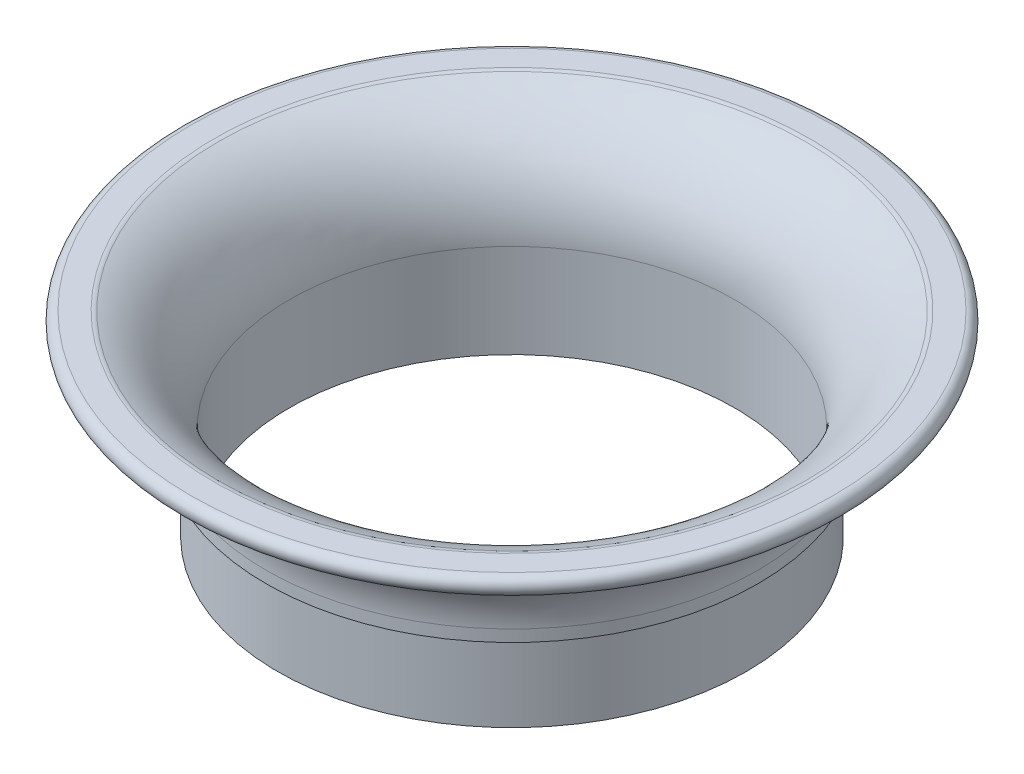
from build123d import *


with BuildPart() as part:
    # Sketch1 → Revolve1 (revolve)
    with BuildSketch(Plane.XY):
        with BuildLine():
            Line((-60.325, -12.7), (-60.325, 12.7))
            ThreePointArc((-60.325, 12.7), (-65.615261982, 29.458507125), (-79.568413516, 40.14232644))
            ThreePointArc((-79.568413516, 40.14232644), (-80.101043736, 40.284456577), (-80.650230019, 40.332314203))
            Line((-80.650230019, 40.332314203), (-87.000230019, 40.332314203))
            ThreePointArc((-87.000230019, 40.332314203), (-89.287995714, 37.794620319), (-86.865795547, 35.384909036))
            ThreePointArc((-86.865795547, 35.384909036), (-72.453781222, 27.884476635), (-66.675, 12.7))
            Line((-66.675, 12.7), (-66.675, 9.525))
            Line((-66.675, 9.525), (-63.5, 9.525))
            Line((-63.5, 9.525), (-63.5, -12.7))
            Line((-63.5, -12.7), (-60.325, -12.7))
        make_face()
    revolve(axis=Axis((0, -12.7, 0), (0, 1, 0)))


solid = part.part
